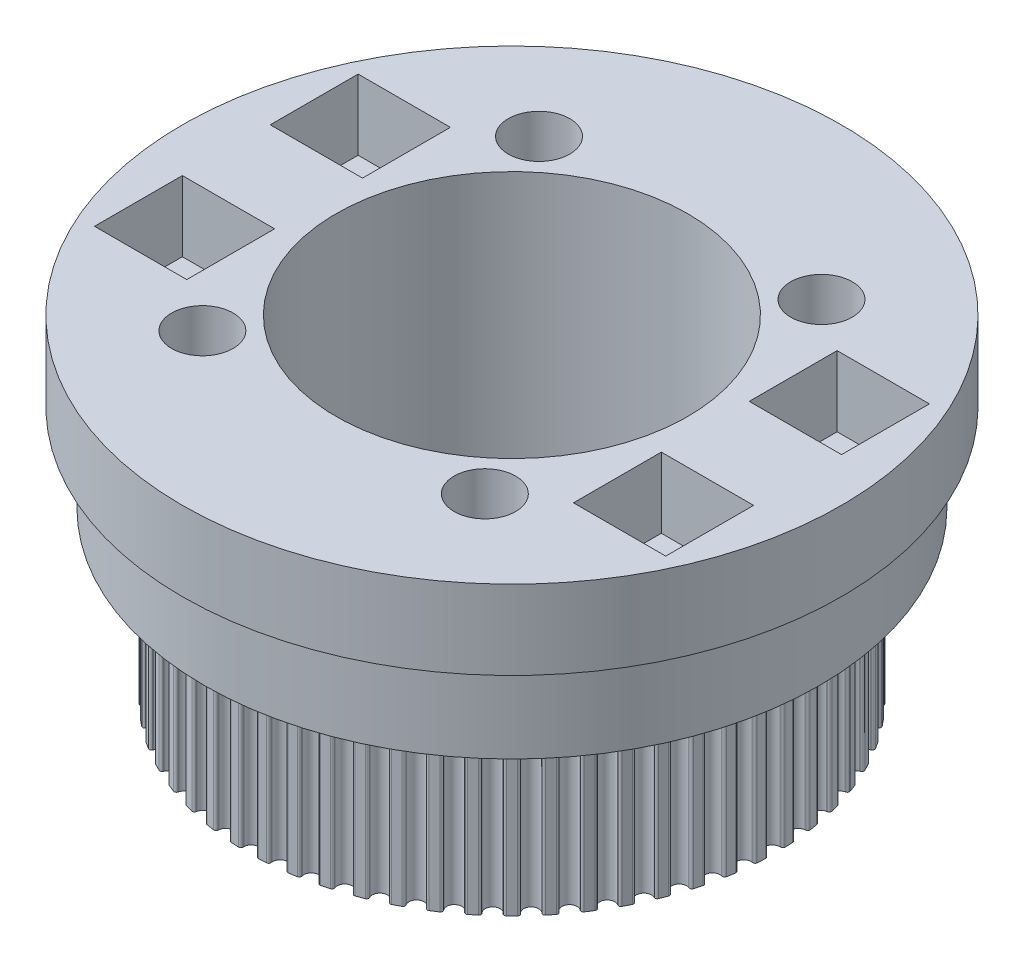
from build123d import *

# Parameters (mm, degrees)
SKETCH1_R                = 37.5
BOSS_EXTRUDE1_DEPTH      = 9
SKETCH3_W                = 10.5
SKETCH3_H                = 10
CUT_EXTRUDE2_DEPTH       = 8
SKETCH4_R                = 35
BOSS_EXTRUDE2_DEPTH      = 10
SKETCH5_R                = 30
BOSS_EXTRUDE3_DEPTH      = 19
SKETCH2_R                = 2.6
CUT_EXTRUDE1_DEPTH       = 66.24185773
SKETCH6_R                = 3.5
CUT_EXTRUDE3_DEPTH       = 10
SKETCH8_R                = 20
CUT_EXTRUDE4_DEPTH       = 66.24185773
CUT_EXTRUDE5_DEPTH       = 19
FILLET1_R                = 0.25
CIRPATTERN1_COUNT        = 60
FILLET1_OF_CIRPATTERN1_R = 0.25


with BuildPart() as part:
    # Sketch1 → Boss-Extrude1 (new body)
    with BuildSketch(Plane(origin=(0, 0, 0), x_dir=(1, 0, 0), z_dir=(0, 1, 0))):
        with Locations(Location((0, 0, 0), (0, 0, 270))):
            Circle(SKETCH1_R)
    extrude(amount=BOSS_EXTRUDE1_DEPTH)

    # Sketch3 → Cut-Extrude2 (cut)
    with BuildSketch(Plane(origin=(0, 9, 0), x_dir=(1, 0, 0), z_dir=(0, 1, 0))):
        with Locations((-27.25, 10)):
            Rectangle(SKETCH3_W, SKETCH3_H)
        with Locations((27.25, 10)):
            Rectangle(SKETCH3_W, SKETCH3_H)
        with Locations((-27.25, -10)):
            Rectangle(SKETCH3_W, SKETCH3_H)
        with Locations((27.25, -10)):
            Rectangle(SKETCH3_W, SKETCH3_H)
    extrude(amount=-CUT_EXTRUDE2_DEPTH, mode=Mode.SUBTRACT)

    # Sketch4 → Boss-Extrude2 (add)
    with BuildSketch(Plane.XZ):
        with Locations(Location((0, 0, 0), (0, 0, 90))):
            Circle(SKETCH4_R)
    extrude(amount=BOSS_EXTRUDE2_DEPTH)

    # Sketch5 → Boss-Extrude3 (add)
    with BuildSketch(Plane.XZ.offset(10)):
        with Locations(Location((0, 0, 0), (0, 0, 270))):
            Circle(SKETCH5_R)
    extrude(amount=BOSS_EXTRUDE3_DEPTH)

    # Sketch2 → Cut-Extrude1 (cut, through all)
    with BuildSketch(Plane(origin=(0, 9, 0), x_dir=(1, 0, 0), z_dir=(0, 1, 0))):
        with Locations(Location((-16.069690242, 19.151111078, 0), (0, 0, 270))):
            Circle(SKETCH2_R)
        with Locations(Location((-16.069690242, -19.151111078, 0), (0, 0, 270))):
            Circle(SKETCH2_R)
        with Locations(Location((16.069690242, -19.151111078, 0), (0, 0, 270))):
            Circle(SKETCH2_R)
        with Locations(Location((16.069690242, 19.151111078, 0), (0, 0, 270))):
            Circle(SKETCH2_R)
    extrude(amount=-CUT_EXTRUDE1_DEPTH, mode=Mode.SUBTRACT)

    # Sketch6 → Cut-Extrude3 (cut)
    with BuildSketch(Plane(origin=(0, 9, 0), x_dir=(1, 0, 0), z_dir=(0, 1, 0))):
        with Locations(Location((-16.069690242, 19.151111078, 0), (0, 0, 270))):
            Circle(SKETCH6_R)
        with Locations(Location((16.069690242, 19.151111078, 0), (0, 0, 270))):
            Circle(SKETCH6_R)
        with Locations(Location((16.069690242, -19.151111078, 0), (0, 0, 270))):
            Circle(SKETCH6_R)
        with Locations(Location((-16.069690242, -19.151111078, 0), (0, 0, 270))):
            Circle(SKETCH6_R)
    extrude(amount=-CUT_EXTRUDE3_DEPTH, mode=Mode.SUBTRACT)

    # Sketch8 → Cut-Extrude4 (cut, through all)
    with BuildSketch(Plane.XZ.offset(29)):
        with Locations(Location((0, 0, 0), (0, 0, 270))):
            Circle(SKETCH8_R)
    extrude(amount=-CUT_EXTRUDE4_DEPTH, mode=Mode.SUBTRACT)

    # Sketch9 → Cut-Extrude5 (cut)
    with BuildSketch(Plane.XZ.offset(29)):
        with BuildLine():
            Line((0.858, 30.638), (0.858, 29.638))
            ThreePointArc((0.858, 29.638), (0, 28.78), (-0.858, 29.638))
            Line((-0.858, 29.638), (-0.858, 30.638))
            ThreePointArc((-0.858, 30.638), (0, 31.496), (0.858, 30.638))
        make_face()
    cut_extrude5 = extrude(amount=-CUT_EXTRUDE5_DEPTH, mode=Mode.SUBTRACT)

    # Fillet1
    fillet1_edges = [part.edges().sort_by_distance(p)[0] for p in [
        (0.858, -19.5, 29.98772809),
        (-0.858, -19.5, 29.98772809),
    ]]
    fillet(fillet1_edges, radius=FILLET1_R)

    # CirPattern1: Cut-Extrude5 ×60 about axis
    cirpattern1_axis = Axis((0, 0, 0), (0, 1, 0))
    for i in range(1, CIRPATTERN1_COUNT):
        add(cut_extrude5.rotate(cirpattern1_axis, i * 360 / CIRPATTERN1_COUNT), mode=Mode.SUBTRACT)

    # Fillet1 of CirPattern1
    fillet1_of_cirpattern1_edges = [part.edges().sort_by_distance(p)[0] for p in [
        (3.98787092, -19.5, 29.733766756),
        (2.281271348, -19.5, 29.913137599),
        (7.074049892, -19.5, 29.154036052),
        (5.39554861, -19.5, 29.510812513),
        (10.082724093, -19.5, 28.254887628),
        (8.450711112, -19.5, 28.78516079),
        (12.980929859, -19.5, 27.046172742),
        (11.413285854, -19.5, 27.744132821),
        (15.736913841, -19.5, 25.541134328),
        (14.250814249, -19.5, 26.399134328),
        (18.320480902, -19.5, 23.756261901),
        (16.93220774, -19.5, 24.764901394),
        (20.70332494, -19.5, 21.711110898),
        (19.42808842, -19.5, 22.859339018),
        (22.859339018, -19.5, 19.42808842),
        (21.711110898, -19.5, 20.70332494),
        (24.764901394, -19.5, 16.93220774),
        (23.756261901, -19.5, 18.320480902),
        (26.399134328, -19.5, 14.250814249),
        (25.541134328, -19.5, 15.736913841),
        (27.744132821, -19.5, 11.413285854),
        (27.046172742, -19.5, 12.980929859),
        (28.78516079, -19.5, 8.450711112),
        (28.254887628, -19.5, 10.082724093),
        (29.510812513, -19.5, 5.39554861),
        (29.154036052, -19.5, 7.074049892),
        (29.913137599, -19.5, 2.281271348),
        (29.733766756, -19.5, 3.98787092),
        (29.98772809, -19.5, -0.858),
        (29.98772809, -19.5, 0.858),
        (29.733766756, -19.5, -3.98787092),
        (29.913137599, -19.5, -2.281271348),
        (29.154036052, -19.5, -7.074049892),
        (29.510812513, -19.5, -5.39554861),
        (28.254887628, -19.5, -10.082724093),
        (28.78516079, -19.5, -8.450711112),
        (27.046172742, -19.5, -12.980929859),
        (27.744132821, -19.5, -11.413285854),
        (25.541134328, -19.5, -15.736913841),
        (26.399134328, -19.5, -14.250814249),
        (23.756261901, -19.5, -18.320480902),
        (24.764901394, -19.5, -16.93220774),
        (21.711110898, -19.5, -20.70332494),
        (22.859339018, -19.5, -19.42808842),
        (19.42808842, -19.5, -22.859339018),
        (20.70332494, -19.5, -21.711110898),
        (16.93220774, -19.5, -24.764901394),
        (18.320480902, -19.5, -23.756261901),
        (14.250814249, -19.5, -26.399134328),
        (15.736913841, -19.5, -25.541134328),
        (11.413285854, -19.5, -27.744132821),
        (12.980929859, -19.5, -27.046172742),
        (8.450711112, -19.5, -28.78516079),
        (10.082724093, -19.5, -28.254887628),
        (5.39554861, -19.5, -29.510812513),
        (7.074049892, -19.5, -29.154036052),
        (2.281271348, -19.5, -29.913137599),
        (3.98787092, -19.5, -29.733766756),
        (-0.858, -19.5, -29.98772809),
        (0.858, -19.5, -29.98772809),
        (-3.98787092, -19.5, -29.733766756),
        (-2.281271348, -19.5, -29.913137599),
        (-7.074049892, -19.5, -29.154036052),
        (-5.39554861, -19.5, -29.510812513),
        (-10.082724093, -19.5, -28.254887628),
        (-8.450711112, -19.5, -28.78516079),
        (-12.980929859, -19.5, -27.046172742),
        (-11.413285854, -19.5, -27.744132821),
        (-15.736913841, -19.5, -25.541134328),
        (-14.250814249, -19.5, -26.399134328),
        (-18.320480902, -19.5, -23.756261901),
        (-16.93220774, -19.5, -24.764901394),
        (-20.70332494, -19.5, -21.711110898),
        (-19.42808842, -19.5, -22.859339018),
        (-22.859339018, -19.5, -19.42808842),
        (-21.711110898, -19.5, -20.70332494),
        (-24.764901394, -19.5, -16.93220774),
        (-23.756261901, -19.5, -18.320480902),
        (-26.399134328, -19.5, -14.250814249),
        (-25.541134328, -19.5, -15.736913841),
        (-27.744132821, -19.5, -11.413285854),
        (-27.046172742, -19.5, -12.980929859),
        (-28.78516079, -19.5, -8.450711112),
        (-28.254887628, -19.5, -10.082724093),
        (-29.510812513, -19.5, -5.39554861),
        (-29.154036052, -19.5, -7.074049892),
        (-29.913137599, -19.5, -2.281271348),
        (-29.733766756, -19.5, -3.98787092),
        (-29.98772809, -19.5, 0.858),
        (-29.98772809, -19.5, -0.858),
        (-29.733766756, -19.5, 3.98787092),
        (-29.913137599, -19.5, 2.281271348),
        (-29.154036052, -19.5, 7.074049892),
        (-29.510812513, -19.5, 5.39554861),
        (-28.254887628, -19.5, 10.082724093),
        (-28.78516079, -19.5, 8.450711112),
        (-27.046172742, -19.5, 12.980929859),
        (-27.744132821, -19.5, 11.413285854),
        (-25.541134328, -19.5, 15.736913841),
        (-26.399134328, -19.5, 14.250814249),
        (-23.756261901, -19.5, 18.320480902),
        (-24.764901394, -19.5, 16.93220774),
        (-21.711110898, -19.5, 20.70332494),
        (-22.859339018, -19.5, 19.42808842),
        (-19.42808842, -19.5, 22.859339018),
        (-20.70332494, -19.5, 21.711110898),
        (-16.93220774, -19.5, 24.764901394),
        (-18.320480902, -19.5, 23.756261901),
        (-14.250814249, -19.5, 26.399134328),
        (-15.736913841, -19.5, 25.541134328),
        (-11.413285854, -19.5, 27.744132821),
        (-12.980929859, -19.5, 27.046172742),
        (-8.450711112, -19.5, 28.78516079),
        (-10.082724093, -19.5, 28.254887628),
        (-5.39554861, -19.5, 29.510812513),
        (-7.074049892, -19.5, 29.154036052),
        (-2.281271348, -19.5, 29.913137599),
        (-3.98787092, -19.5, 29.733766756),
    ]]
    fillet(fillet1_of_cirpattern1_edges, radius=FILLET1_OF_CIRPATTERN1_R)


solid = part.part
